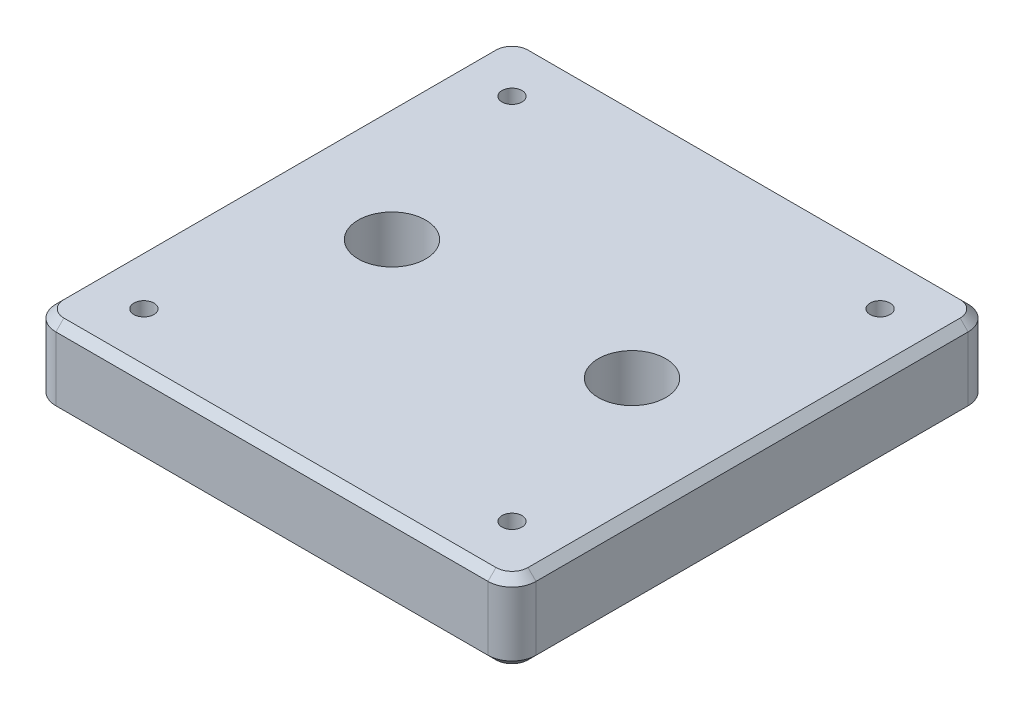
from build123d import *

# Parameters (mm, degrees)
SKETCH1_W                                 = 60
SKETCH1_H                                 = 60
BOSS_EXTRUDE1_DEPTH                       = 10
FILLET1_R                                 = 3
M3X0_5_TAPPED_HOLE1_OUTLINE_R             = 1.25
M3X0_5_TAPPED_HOLE1_DEPTH                 = 10
CSK_FOR_8_FLAT_HEAD_MACHINE_SCREW_2_COUNT = 2
CSK_FOR_8_FLAT_HEAD_MACHINE_SCREW_2_PITCH = 30
CHAMFER1_SIZE                             = 1


# Read off the part's stored shape, not the designer's step: M3x0.5 Tapped Hole1
with BuildPart() as part:
    # Sketch1 → Boss-Extrude1 (new body)
    with BuildSketch(Plane(origin=(0, 0, 0), x_dir=(1, 0, 0), z_dir=(0, 1, 0))):
        Rectangle(SKETCH1_W, SKETCH1_H)
    extrude(amount=BOSS_EXTRUDE1_DEPTH)

    # Fillet1
    fillet1_edges = [part.edges().sort_by_distance(p)[0] for p in [
        (30, 5, 30),
        (-30, 5, 30),
        (-30, 5, -30),
        (30, 5, -30),
    ]]
    fillet(fillet1_edges, radius=FILLET1_R)

    # M3x0.5 Tapped Hole1 outline → M3x0.5 Tapped Hole1 (cut)
    with BuildSketch(Plane(origin=(0, 0, 0), x_dir=(1, 0, 0), z_dir=(0, 1, 0))):
        with Locations((23, -23)):
            Circle(M3X0_5_TAPPED_HOLE1_OUTLINE_R)
        with Locations((-23, 23)):
            Circle(M3X0_5_TAPPED_HOLE1_OUTLINE_R)
        with Locations((-23, -23)):
            Circle(M3X0_5_TAPPED_HOLE1_OUTLINE_R)
        with Locations((23, 23)):
            Circle(M3X0_5_TAPPED_HOLE1_OUTLINE_R)
    extrude(amount=M3X0_5_TAPPED_HOLE1_DEPTH, mode=Mode.SUBTRACT)

    # Sketch7 → CSK for #8 Flat Head Machine Screw (100)2 (revolve, cut)
    with BuildSketch(Plane(origin=(15, 10, 0), x_dir=(0, 0, 1), z_dir=(1, 0, 0))):
        Polygon((0, 0), (0, 10), (2.2479, 10), (2.2479, 7.651767624), (4.2164, 6), (4.2164, 0), align=None)
    csk_for_8_flat_head_machine_screw_100 = revolve(axis=Axis((15, 16.35, 0), (0, -1, 0)), mode=Mode.SUBTRACT)

    # CSK for _8 Flat Head Machine Screw _ 2: CSK for #8 Flat Head Machine Screw (100)2 ×2
    with Locations(*[(-i * CSK_FOR_8_FLAT_HEAD_MACHINE_SCREW_2_PITCH, 0, 0) for i in range(1, CSK_FOR_8_FLAT_HEAD_MACHINE_SCREW_2_COUNT)]):
        add(csk_for_8_flat_head_machine_screw_100, mode=Mode.SUBTRACT)

    # Chamfer1
    chamfer1_edges = [part.edges().sort_by_distance(p)[0] for p in [
        (-30, 0, 0),
        (-30, 10, 0),
        (30, 0, 0),
        (0, 0, 30),
        (0, 0, -30),
        (-29.121320344, 0, 29.121320344),
        (29.121320344, 0, 29.121320344),
        (29.121320344, 0, -29.121320344),
        (-29.121320344, 0, -29.121320344),
        (0, 10, -30),
        (30, 10, 0),
        (0, 10, 30),
        (-29.121320344, 10, 29.121320344),
        (29.121320344, 10, 29.121320344),
        (29.121320344, 10, -29.121320344),
        (-29.121320344, 10, -29.121320344),
    ]]
    chamfer(chamfer1_edges, length=CHAMFER1_SIZE)


solid = part.part
